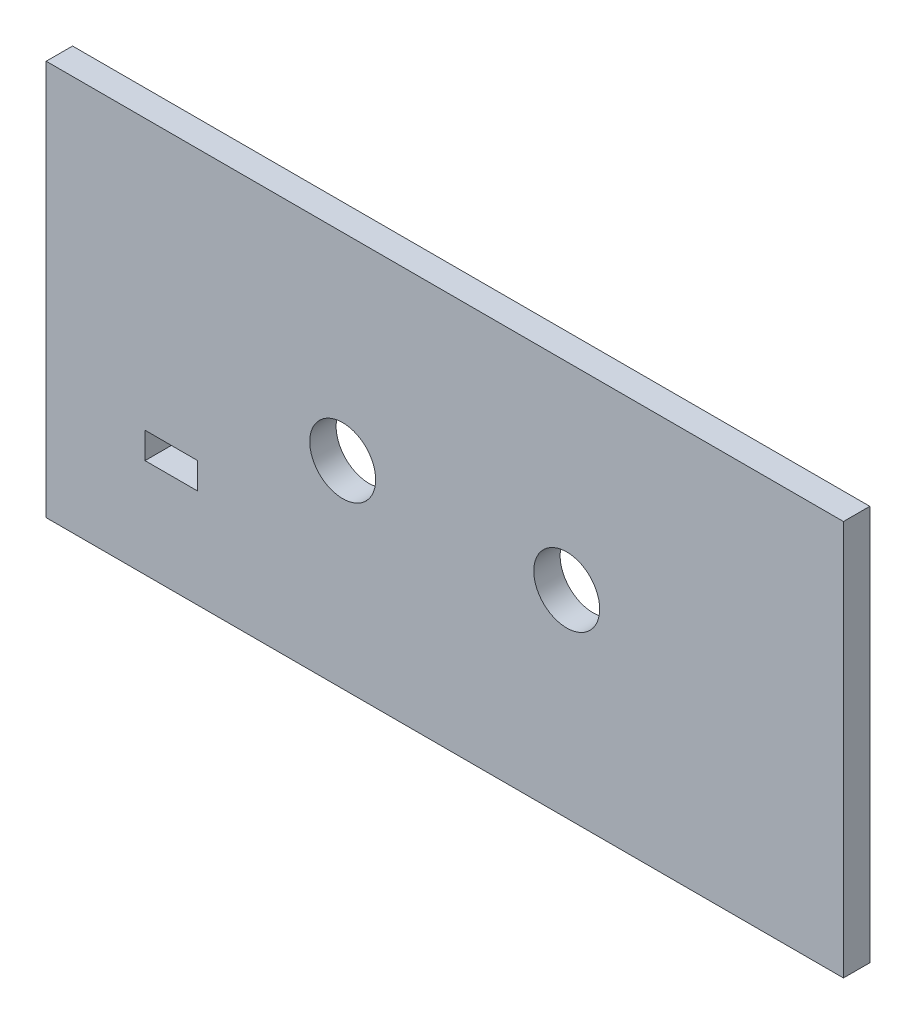
from build123d import *

# Parameters (mm, degrees)
SKETCH1_W           = 121
SKETCH1_H           = 60
SKETCH1_R           = 5
SKETCH1_W_2         = 8
SKETCH1_H_2         = 4
BOSS_EXTRUDE1_DEPTH = 4


with BuildPart() as part:
    # Sketch1 → Boss-Extrude1 (new body)
    with BuildSketch(Plane.XY):
        with Locations((-18.5, 11.603893248)):
            Rectangle(SKETCH1_W, SKETCH1_H)
        with Locations((-34, 11.603893248)):
            Circle(SKETCH1_R, mode=Mode.SUBTRACT)
        with Locations((0, 11.603893248)):
            Circle(SKETCH1_R, mode=Mode.SUBTRACT)
        with Locations((-60, -1.396106752)):
            Rectangle(SKETCH1_W_2, SKETCH1_H_2, mode=Mode.SUBTRACT)
    extrude(amount=BOSS_EXTRUDE1_DEPTH)


solid = part.part
